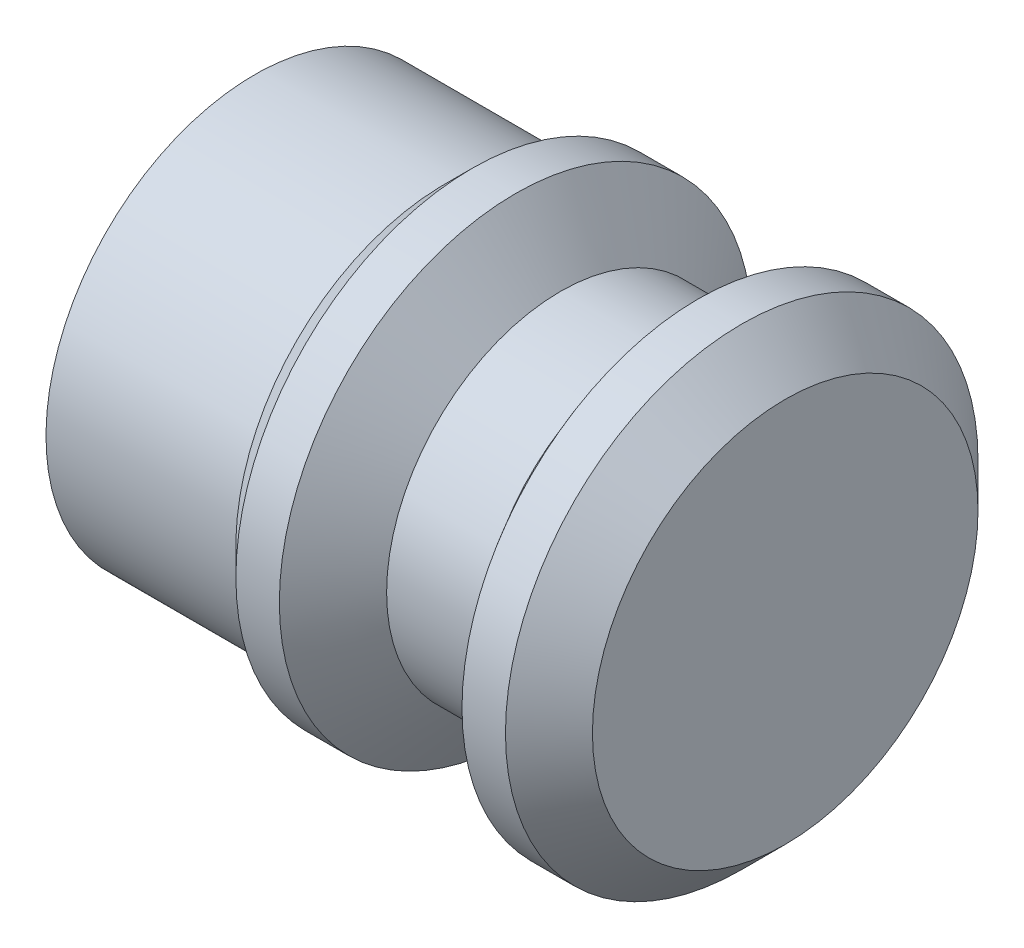
from build123d import *

# Parameters (mm, degrees)
CHAMFER1_SIZE            = 0.75
BOSS_EXTRUDE1_DEPTH      = 3
BOSS_EXTRUDE1_DEPTH_BACK = 1
SKETCH2_R                = 3.6
SKETCH3_R                = 0.55
BOSS_EXTRUDE2_DEPTH      = 2
CUT_EXTRUDE1_DEPTH       = 2.5


with BuildPart() as part:
    # Sketch1 → Revolve1 (revolve)
    with BuildSketch(Plane(origin=(0, 0, 0), x_dir=(1, 0, 0), z_dir=(0, 1, 0))):
        Polygon((-6.15, 4.075), (-6.15, 0), (0, 0), (0, 4.075), (-1.5, 4.075), (-2.275, 3), (-3.075, 3), (-3.875, 3), (-4.65, 4.075), align=None)
    revolve(axis=Axis((-23.01300908, 0, 0), (1, 0, 0)))

    # Chamfer1
    chamfer1_edges = [part.edges().sort_by_distance(p)[0] for p in [
        (0, 0, 4.075),
        (-6.15, 0, 4.075),
    ]]
    chamfer(chamfer1_edges, length=CHAMFER1_SIZE)

    # Sketch2 → Boss-Extrude1 (add, two sides: drawn at the far end of the back side and taken through both)
    with BuildSketch(Plane.ZY.offset(6.15).offset(-BOSS_EXTRUDE1_DEPTH_BACK)):
        Circle(SKETCH2_R)
    extrude(amount=BOSS_EXTRUDE1_DEPTH + BOSS_EXTRUDE1_DEPTH_BACK)

    # Sketch3 → Boss-Extrude2 (add)
    with BuildSketch(Plane.ZY.offset(9.15)):
        Circle(SKETCH3_R)
    extrude(amount=BOSS_EXTRUDE2_DEPTH)

    # Sketch4 → Cut-Extrude1 (cut)
    with BuildSketch(Plane.ZY.offset(9.15)):
        with BuildLine():
            Line((0, -3.6), (0, -2.05))
            ThreePointArc((0, -2.05), (-1.081944444, -1.741234108), (-1.837969336, -0.907947531))
            Line((-1.837969336, -0.907947531), (-3.227653469, -1.594444444))
            ThreePointArc((-3.227653469, -1.594444444), (-1.9, -3.05777697), (0, -3.6))
        make_face()
    extrude(amount=-CUT_EXTRUDE1_DEPTH, mode=Mode.SUBTRACT)


solid = part.part
